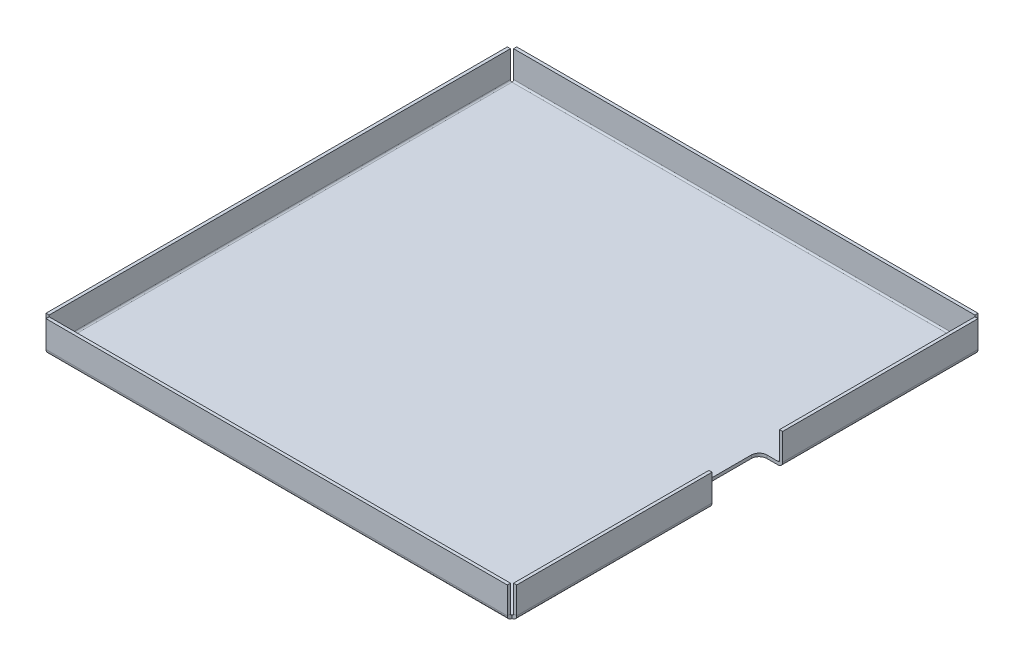
from build123d import *

# Parameters (mm, degrees)
BASES_W            = 29.4
BASES_H            = 29.4
BASE_DEPTH         = 0.2
EDGE_FLANGE1_DEPTH = 29.4
EDGE_FLANGE2_DEPTH = 29.4
EDGE_FLANGE3_DEPTH = 29.4
EDGE_FLANGE4_DEPTH = 29.4
VENT_DEPTH         = 42.363026969
VENT_DEPTH_BACK    = 42.363026969


# Sheet-metal steps are written as plain solids
with BuildPart() as part:
    # BaseS → Base (new body)
    with BuildSketch(Plane(origin=(0, 2, 0), x_dir=(1, 0, 0), z_dir=(0, 1, 0))):
        Rectangle(BASES_W, BASES_H)
    extrude(amount=-BASE_DEPTH)

    # Edge-Flange1 section (across the edge) → Edge-Flange1 (add)
    with BuildSketch(Plane(origin=(-14.7, 2, 14.8), x_dir=(0, 0, -1), z_dir=(1, 0, 0))):
        with BuildLine():
            Line((-0.2, 0.1), (-0.2, 1.8))
            Line((-0.2, 1.8), (0, 1.8))
            Line((0, 1.8), (0, 0.1))
            ThreePointArc((0, 0.1), (0.029289322, 0.029289322), (0.1, 0))
            Line((0.1, 0), (0.1, -0.2))
            ThreePointArc((0.1, -0.2), (-0.112132034, -0.112132034), (-0.2, 0.1))
        make_face()
    extrude(amount=EDGE_FLANGE1_DEPTH)

    # Edge-Flange2 section (across the edge) → Edge-Flange2 (add)
    with BuildSketch(Plane(origin=(14.7, 2, -14.8), x_dir=(0, 0, 1), z_dir=(-1, 0, 0))):
        with BuildLine():
            Line((-0.2, 0.1), (-0.2, 1.8))
            Line((-0.2, 1.8), (0, 1.8))
            Line((0, 1.8), (0, 0.1))
            ThreePointArc((0, 0.1), (0.029289322, 0.029289322), (0.1, 0))
            Line((0.1, 0), (0.1, -0.2))
            ThreePointArc((0.1, -0.2), (-0.112132034, -0.112132034), (-0.2, 0.1))
        make_face()
    extrude(amount=EDGE_FLANGE2_DEPTH)

    # Edge-Flange3 section (across the edge) → Edge-Flange3 (add)
    with BuildSketch(Plane(origin=(14.8, 2, 14.7), x_dir=(-1, 0, 0), z_dir=(0, 0, -1))):
        with BuildLine():
            Line((-0.2, 0.1), (-0.2, 1.8))
            Line((-0.2, 1.8), (0, 1.8))
            Line((0, 1.8), (0, 0.1))
            ThreePointArc((0, 0.1), (0.029289322, 0.029289322), (0.1, 0))
            Line((0.1, 0), (0.1, -0.2))
            ThreePointArc((0.1, -0.2), (-0.112132034, -0.112132034), (-0.2, 0.1))
        make_face()
    extrude(amount=EDGE_FLANGE3_DEPTH)

    # Edge-Flange4 section (across the edge) → Edge-Flange4 (add)
    with BuildSketch(Plane(origin=(-14.8, 2, -14.7), x_dir=(1, 0, 0), z_dir=(0, 0, 1))):
        with BuildLine():
            Line((-0.2, 0.1), (-0.2, 1.8))
            Line((-0.2, 1.8), (0, 1.8))
            Line((0, 1.8), (0, 0.1))
            ThreePointArc((0, 0.1), (0.029289322, 0.029289322), (0.1, 0))
            Line((0.1, 0), (0.1, -0.2))
            ThreePointArc((0.1, -0.2), (-0.112132034, -0.112132034), (-0.2, 0.1))
        make_face()
    extrude(amount=EDGE_FLANGE4_DEPTH)

    # VentS → Vent (cut, two sides: drawn at the far end of the back side and taken through both)
    with BuildSketch(Plane(origin=(-15.1, 1.8, -13.3), x_dir=(1, 0, 0), z_dir=(0, 1, 0)).offset(-VENT_DEPTH_BACK)):
        with BuildLine():
            Line((30.1, -11.05), (30.1, -15.55))
            Line((30.1, -15.55), (29.1, -15.55))
            ThreePointArc((29.1, -15.55), (28.746446609, -15.403553391), (28.6, -15.05))
            Line((28.6, -15.05), (28.6, -11.55))
            ThreePointArc((28.6, -11.55), (28.746446609, -11.196446609), (29.1, -11.05))
            Line((29.1, -11.05), (30.1, -11.05))
        make_face()
    extrude(amount=VENT_DEPTH + VENT_DEPTH_BACK, mode=Mode.SUBTRACT)


solid = part.part
